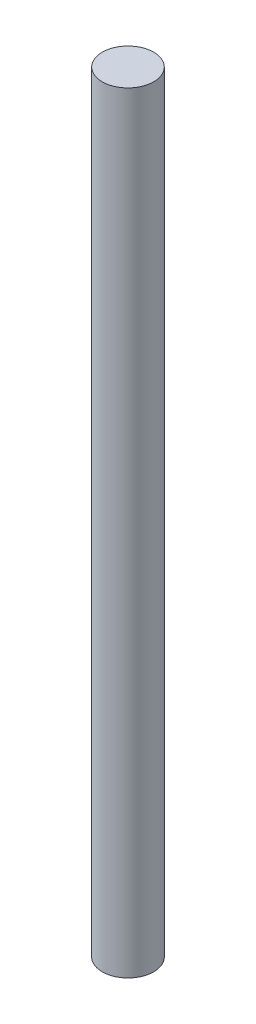
from build123d import *

# Parameters (mm, degrees)
SKETCH_1_R      = 5
EXTRUDE_1_DEPTH = 150


with BuildPart() as part:
    # Эскиз1 → Бобышка-Вытянуть1 (new body)
    with BuildSketch(Plane(origin=(0, 0, 0), x_dir=(1, 0, 0), z_dir=(0, 1, 0))):
        Circle(SKETCH_1_R)
    extrude(amount=EXTRUDE_1_DEPTH)


solid = part.part
